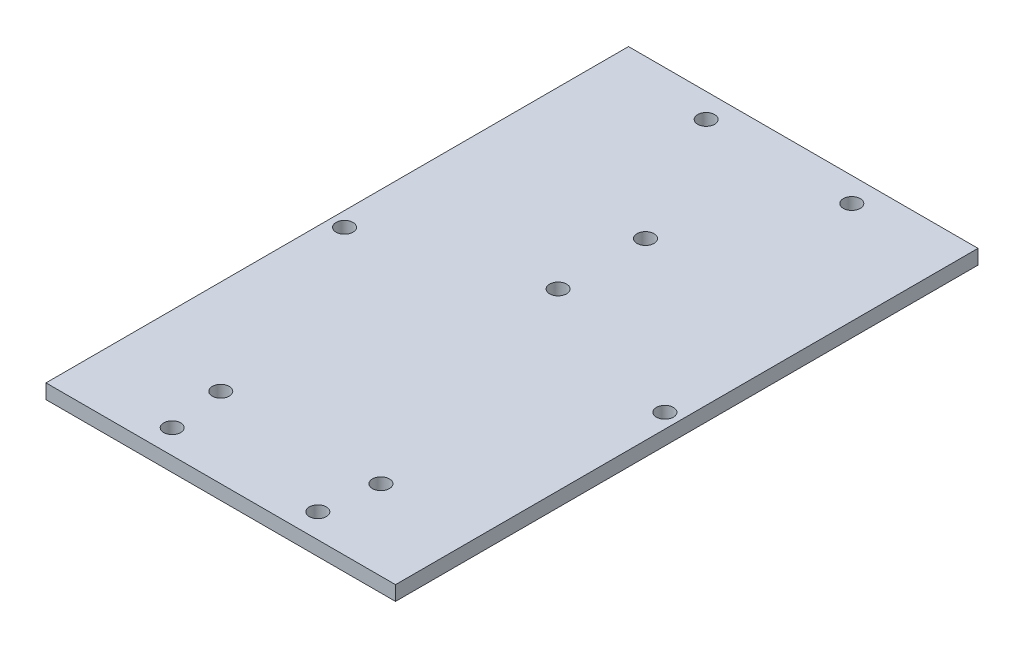
from build123d import *

# Parameters (mm, degrees)
SKETCH1_W           = 72
SKETCH1_H           = 120
SKETCH1_R           = 1.75
BOSS_EXTRUDE1_DEPTH = 3


with BuildPart() as part:
    # Sketch1 → Boss-Extrude1 (new body)
    with BuildSketch(Plane(origin=(0, 0, 0), x_dir=(1, 0, 0), z_dir=(0, 1, 0))):
        Rectangle(SKETCH1_W, SKETCH1_H)
        with Locations((-15, -55)):
            Circle(SKETCH1_R, mode=Mode.SUBTRACT)
        with Locations((-16.5, -43.5)):
            Circle(SKETCH1_R, mode=Mode.SUBTRACT)
        with Locations((-33, -1.5)):
            Circle(SKETCH1_R, mode=Mode.SUBTRACT)
        with Locations((15, -55)):
            Circle(SKETCH1_R, mode=Mode.SUBTRACT)
        with Locations((16.5, -43.5)):
            Circle(SKETCH1_R, mode=Mode.SUBTRACT)
        with Locations((33, -1.5)):
            Circle(SKETCH1_R, mode=Mode.SUBTRACT)
        with Locations((-15, 55)):
            Circle(SKETCH1_R, mode=Mode.SUBTRACT)
        with BuildLine():
            ThreePointArc((0, 7.75), (-1.237436867, 10.737436867), (1.75, 9.5))
            ThreePointArc((1.75, 9.5), (1.237436867, 8.262563133), (0, 7.75))
        make_face(mode=Mode.SUBTRACT)
        with Locations((0, 27.5)):
            Circle(SKETCH1_R, mode=Mode.SUBTRACT)
        with Locations((15, 55)):
            Circle(SKETCH1_R, mode=Mode.SUBTRACT)
    extrude(amount=BOSS_EXTRUDE1_DEPTH)


solid = part.part
